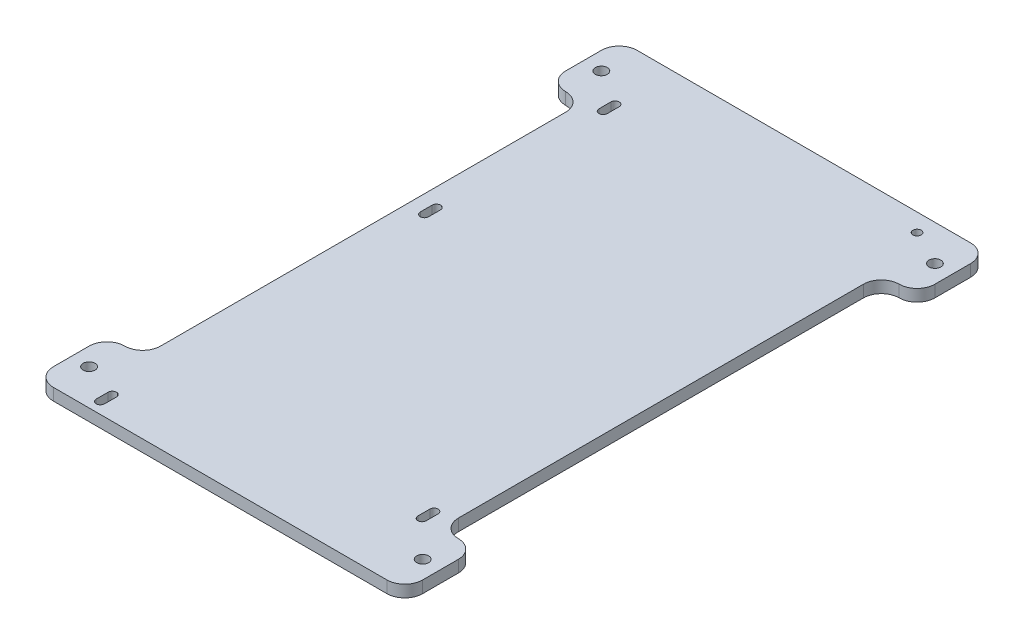
from build123d import *

# Parameters (mm, degrees)
SKETCH1_W           = 125
SKETCH1_H           = 245
BOSS_EXTRUDE1_DEPTH = 5
SKETCH2_W           = 15
SKETCH2_H           = 30
BOSS_EXTRUDE2_DEPTH = 5
SKETCH3_R           = 2.5
CUT_EXTRUDE1_DEPTH  = 158.368235883
SKETCH4_R           = 1.75
CUT_EXTRUDE2_DEPTH  = 158.368235883
FILLET4_R           = 7.5


with BuildPart() as part:
    # Sketch1 → Boss-Extrude1 (new body)
    with BuildSketch(Plane(origin=(0, 0, 0), x_dir=(1, 0, 0), z_dir=(0, 1, 0))):
        with Locations((-8.498498498, 9.196696697)):
            Rectangle(SKETCH1_W, SKETCH1_H)
    extrude(amount=BOSS_EXTRUDE1_DEPTH)

    # Sketch2 → Boss-Extrude2 (add)
    with BuildSketch(Plane(origin=(0, 5, 0), x_dir=(1, 0, 0), z_dir=(0, 1, 0))):
        with Locations((61.501501502, 116.696696697)):
            Rectangle(SKETCH2_W, SKETCH2_H)
        with Locations((-78.498498498, 116.696696697)):
            Rectangle(SKETCH2_W, SKETCH2_H)
        with Locations((-78.498498498, -98.303303303)):
            Rectangle(SKETCH2_W, SKETCH2_H)
        with Locations((61.501501502, -98.303303303)):
            Rectangle(SKETCH2_W, SKETCH2_H)
    extrude(amount=-BOSS_EXTRUDE2_DEPTH)

    # Sketch3 → Cut-Extrude1 (cut, through all)
    with BuildSketch(Plane.XZ):
        with Locations(Location((-78.498498498, 98.303303303, 0), (0, 0, 270))):
            Circle(SKETCH3_R)
        with Locations(Location((61.501501502, 98.303303303, 0), (0, 0, 270))):
            Circle(SKETCH3_R)
        with Locations(Location((-78.498498498, -116.696696697, 0), (0, 0, 270))):
            Circle(SKETCH3_R)
        with Locations(Location((61.501501502, -116.696696697, 0), (0, 0, 270))):
            Circle(SKETCH3_R)
    extrude(amount=-CUT_EXTRUDE1_DEPTH, mode=Mode.SUBTRACT)

    # Sketch4 → Cut-Extrude2 (cut, through all)
    with BuildSketch(Plane(origin=(0, 5, 0), x_dir=(1, 0, 0), z_dir=(0, 1, 0))):
        with Locations(Location((46.501501502, 124.196696697, 0), (0, 0, 270))):
            Circle(SKETCH4_R)
        with BuildLine():
            Line((44.751501502, -83.553303303), (44.751501502, -78.553303303))
            ThreePointArc((44.751501502, -78.553303303), (46.501501502, -76.803303303), (48.251501502, -78.553303303))
            Line((48.251501502, -78.553303303), (48.251501502, -83.553303303))
            ThreePointArc((48.251501502, -83.553303303), (46.501501502, -85.303303303), (44.751501502, -83.553303303))
        make_face()
        with BuildLine():
            Line((-65.248498498, -108.553303303), (-65.248498498, -103.553303303))
            ThreePointArc((-65.248498498, -103.553303303), (-63.498498498, -101.803303303), (-61.748498498, -103.553303303))
            Line((-61.748498498, -103.553303303), (-61.748498498, -108.553303303))
            ThreePointArc((-61.748498498, -108.553303303), (-63.498498498, -110.303303303), (-65.248498498, -108.553303303))
        make_face()
        with BuildLine():
            Line((-65.248498498, 27.446696697), (-65.248498498, 32.446696697))
            ThreePointArc((-65.248498498, 32.446696697), (-63.498498498, 34.196696697), (-61.748498498, 32.446696697))
            Line((-61.748498498, 32.446696697), (-61.748498498, 27.446696697))
            ThreePointArc((-61.748498498, 27.446696697), (-63.498498498, 25.696696697), (-65.248498498, 27.446696697))
        make_face()
        with BuildLine():
            Line((-65.248498498, 102.446696697), (-65.248498498, 107.446696697))
            ThreePointArc((-65.248498498, 107.446696697), (-63.498498498, 109.196696697), (-61.748498498, 107.446696697))
            Line((-61.748498498, 107.446696697), (-61.748498498, 102.446696697))
            ThreePointArc((-61.748498498, 102.446696697), (-63.498498498, 100.696696697), (-65.248498498, 102.446696697))
        make_face()
    extrude(amount=-CUT_EXTRUDE2_DEPTH, mode=Mode.SUBTRACT)

    # Fillet4
    fillet4_edges = [part.edges().sort_by_distance(p)[0] for p in [
        (-70.998498498, 2.5, 83.303303303),
        (-85.998498498, 2.5, 83.303303303),
        (-85.998498498, 2.5, 113.303303303),
        (69.001501502, 2.5, 113.303303303),
        (69.001501502, 2.5, 83.303303303),
        (54.001501502, 2.5, 83.303303303),
        (54.001501502, 2.5, -101.696696697),
        (69.001501502, 2.5, -101.696696697),
        (69.001501502, 2.5, -131.696696697),
        (-85.998498498, 2.5, -131.696696697),
        (-70.998498498, 2.5, -101.696696697),
        (-85.998498498, 2.5, -101.696696697),
    ]]
    fillet(fillet4_edges, radius=FILLET4_R - 0.0001)  # a hair under: the kernel refuses the full size


solid = part.part
